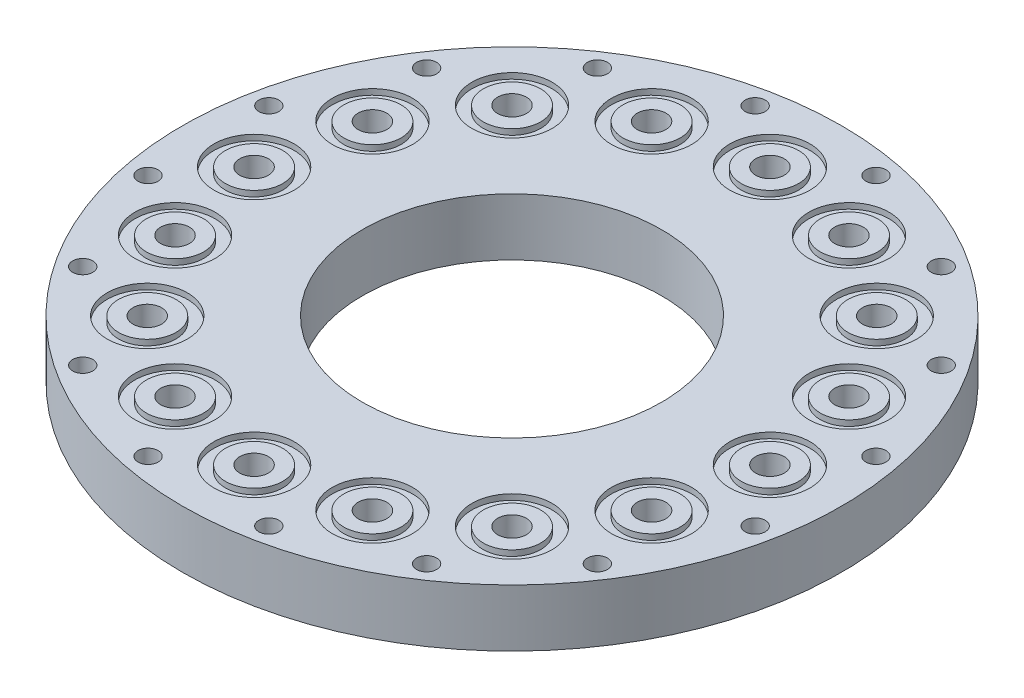
from build123d import *

# Parameters (mm, degrees)
SKETCH1_R           = 57.5
SKETCH1_R_2         = 1.75
SKETCH1_R_3         = 26.1
SKETCH1_R_4         = 2.5
BOSS_EXTRUDE1_DEPTH = 10
SKETCH2_R           = 7
SKETCH2_R_2         = 5
CUT_EXTRUDE1_DEPTH  = 1


with BuildPart() as part:
    # Sketch1 → Boss-Extrude1 (new body)
    with BuildSketch(Plane(origin=(0, 0, 0), x_dir=(1, 0, 0), z_dir=(0, 1, 0))):
        Circle(SKETCH1_R)
        with Locations((-10.534877389, 52.962405142)):
            Circle(SKETCH1_R_2, mode=Mode.SUBTRACT)
        with Locations((10.534877389, 52.962405142)):
            Circle(SKETCH1_R_2, mode=Mode.SUBTRACT)
        with Locations((30.000792583, 44.899359064)):
            Circle(SKETCH1_R_2, mode=Mode.SUBTRACT)
        with Locations((44.899359064, 30.000792583)):
            Circle(SKETCH1_R_2, mode=Mode.SUBTRACT)
        with Locations((52.962405142, 10.534877389)):
            Circle(SKETCH1_R_2, mode=Mode.SUBTRACT)
        with Locations((52.962405142, -10.534877389)):
            Circle(SKETCH1_R_2, mode=Mode.SUBTRACT)
        with Locations((44.899359064, -30.000792583)):
            Circle(SKETCH1_R_2, mode=Mode.SUBTRACT)
        with Locations((30.000792583, -44.899359064)):
            Circle(SKETCH1_R_2, mode=Mode.SUBTRACT)
        with Locations((10.534877389, -52.962405142)):
            Circle(SKETCH1_R_2, mode=Mode.SUBTRACT)
        with Locations((-10.534877389, -52.962405142)):
            Circle(SKETCH1_R_2, mode=Mode.SUBTRACT)
        with Locations((-30.000792583, -44.899359064)):
            Circle(SKETCH1_R_2, mode=Mode.SUBTRACT)
        with Locations((-44.899359064, -30.000792583)):
            Circle(SKETCH1_R_2, mode=Mode.SUBTRACT)
        Circle(SKETCH1_R_3, mode=Mode.SUBTRACT)
        with Locations((0, 45)):
            Circle(SKETCH1_R_4, mode=Mode.SUBTRACT)
        with Locations((17.220754456, 41.574578963)):
            Circle(SKETCH1_R_4, mode=Mode.SUBTRACT)
        with Locations((31.819805153, 31.819805153)):
            Circle(SKETCH1_R_4, mode=Mode.SUBTRACT)
        with Locations((41.574578963, 17.220754456)):
            Circle(SKETCH1_R_4, mode=Mode.SUBTRACT)
        with Locations((45, 0)):
            Circle(SKETCH1_R_4, mode=Mode.SUBTRACT)
        with Locations((41.574578963, -17.220754456)):
            Circle(SKETCH1_R_4, mode=Mode.SUBTRACT)
        with Locations((31.819805153, -31.819805153)):
            Circle(SKETCH1_R_4, mode=Mode.SUBTRACT)
        with Locations((17.220754456, -41.574578963)):
            Circle(SKETCH1_R_4, mode=Mode.SUBTRACT)
        with Locations((0, -45)):
            Circle(SKETCH1_R_4, mode=Mode.SUBTRACT)
        with Locations((-17.220754456, -41.574578963)):
            Circle(SKETCH1_R_4, mode=Mode.SUBTRACT)
        with Locations((-31.819805153, -31.819805153)):
            Circle(SKETCH1_R_4, mode=Mode.SUBTRACT)
        with Locations((-41.574578963, -17.220754456)):
            Circle(SKETCH1_R_4, mode=Mode.SUBTRACT)
        with Locations((-45, 0)):
            Circle(SKETCH1_R_4, mode=Mode.SUBTRACT)
        with Locations((-41.574578963, 17.220754456)):
            Circle(SKETCH1_R_4, mode=Mode.SUBTRACT)
        with Locations((-31.819805153, 31.819805153)):
            Circle(SKETCH1_R_4, mode=Mode.SUBTRACT)
        with Locations((-17.220754456, 41.574578963)):
            Circle(SKETCH1_R_4, mode=Mode.SUBTRACT)
        with Locations((-52.962405142, -10.534877389)):
            Circle(SKETCH1_R_2, mode=Mode.SUBTRACT)
        with Locations((-52.962405142, 10.534877389)):
            Circle(SKETCH1_R_2, mode=Mode.SUBTRACT)
        with Locations((-44.899359064, 30.000792583)):
            Circle(SKETCH1_R_2, mode=Mode.SUBTRACT)
        with Locations((-30.000792583, 44.899359064)):
            Circle(SKETCH1_R_2, mode=Mode.SUBTRACT)
    extrude(amount=BOSS_EXTRUDE1_DEPTH)

    # Sketch2 → Cut-Extrude1 (cut)
    # profile 1 of 16: a face of its own
    with BuildSketch(Plane(origin=(0, 10, 0), x_dir=(1, 0, 0), z_dir=(0, 1, 0))):
        with Locations((0, 45)):
            Circle(SKETCH2_R)
        with Locations((0, 45)):
            Circle(SKETCH2_R_2, mode=Mode.SUBTRACT)
    # profile 2 of 16: a face of its own
    with BuildSketch(Plane(origin=(0, 10, 0), x_dir=(1, 0, 0), z_dir=(0, 1, 0))):
        with Locations((17.220754456, 41.574578963)):
            Circle(SKETCH2_R)
        with Locations((17.220754456, 41.574578963)):
            Circle(SKETCH2_R_2, mode=Mode.SUBTRACT)
    # profile 3 of 16: a face of its own
    with BuildSketch(Plane(origin=(0, 10, 0), x_dir=(1, 0, 0), z_dir=(0, 1, 0))):
        with Locations((31.819805153, 31.819805153)):
            Circle(SKETCH2_R)
        with Locations((31.819805153, 31.819805153)):
            Circle(SKETCH2_R_2, mode=Mode.SUBTRACT)
    # profile 4 of 16: a face of its own
    with BuildSketch(Plane(origin=(0, 10, 0), x_dir=(1, 0, 0), z_dir=(0, 1, 0))):
        with Locations((41.574578963, 17.220754456)):
            Circle(SKETCH2_R)
        with Locations((41.574578963, 17.220754456)):
            Circle(SKETCH2_R_2, mode=Mode.SUBTRACT)
    # profile 5 of 16: a face of its own
    with BuildSketch(Plane(origin=(0, 10, 0), x_dir=(1, 0, 0), z_dir=(0, 1, 0))):
        with Locations((45, 0)):
            Circle(SKETCH2_R)
        with Locations((45, 0)):
            Circle(SKETCH2_R_2, mode=Mode.SUBTRACT)
    # profile 6 of 16: a face of its own
    with BuildSketch(Plane(origin=(0, 10, 0), x_dir=(1, 0, 0), z_dir=(0, 1, 0))):
        with Locations((41.574578963, -17.220754456)):
            Circle(SKETCH2_R)
        with Locations((41.574578963, -17.220754456)):
            Circle(SKETCH2_R_2, mode=Mode.SUBTRACT)
    # profile 7 of 16: a face of its own
    with BuildSketch(Plane(origin=(0, 10, 0), x_dir=(1, 0, 0), z_dir=(0, 1, 0))):
        with Locations((31.819805153, -31.819805153)):
            Circle(SKETCH2_R)
        with Locations((31.819805153, -31.819805153)):
            Circle(SKETCH2_R_2, mode=Mode.SUBTRACT)
    # profile 8 of 16: a face of its own
    with BuildSketch(Plane(origin=(0, 10, 0), x_dir=(1, 0, 0), z_dir=(0, 1, 0))):
        with Locations((17.220754456, -41.574578963)):
            Circle(SKETCH2_R)
        with Locations((17.220754456, -41.574578963)):
            Circle(SKETCH2_R_2, mode=Mode.SUBTRACT)
    # profile 9 of 16: a face of its own
    with BuildSketch(Plane(origin=(0, 10, 0), x_dir=(1, 0, 0), z_dir=(0, 1, 0))):
        with Locations((0, -45)):
            Circle(SKETCH2_R)
        with Locations((0, -45)):
            Circle(SKETCH2_R_2, mode=Mode.SUBTRACT)
    # profile 10 of 16: a face of its own
    with BuildSketch(Plane(origin=(0, 10, 0), x_dir=(1, 0, 0), z_dir=(0, 1, 0))):
        with Locations((-17.220754456, -41.574578963)):
            Circle(SKETCH2_R)
        with Locations((-17.220754456, -41.574578963)):
            Circle(SKETCH2_R_2, mode=Mode.SUBTRACT)
    # profile 11 of 16: a face of its own
    with BuildSketch(Plane(origin=(0, 10, 0), x_dir=(1, 0, 0), z_dir=(0, 1, 0))):
        with Locations((-31.819805153, -31.819805153)):
            Circle(SKETCH2_R)
        with Locations((-31.819805153, -31.819805153)):
            Circle(SKETCH2_R_2, mode=Mode.SUBTRACT)
    # profile 12 of 16: a face of its own
    with BuildSketch(Plane(origin=(0, 10, 0), x_dir=(1, 0, 0), z_dir=(0, 1, 0))):
        with Locations((-41.574578963, -17.220754456)):
            Circle(SKETCH2_R)
        with Locations((-41.574578963, -17.220754456)):
            Circle(SKETCH2_R_2, mode=Mode.SUBTRACT)
    # profile 13 of 16: a face of its own
    with BuildSketch(Plane(origin=(0, 10, 0), x_dir=(1, 0, 0), z_dir=(0, 1, 0))):
        with Locations((-45, 0)):
            Circle(SKETCH2_R)
        with Locations((-45, 0)):
            Circle(SKETCH2_R_2, mode=Mode.SUBTRACT)
    # profile 14 of 16: a face of its own
    with BuildSketch(Plane(origin=(0, 10, 0), x_dir=(1, 0, 0), z_dir=(0, 1, 0))):
        with Locations((-41.574578963, 17.220754456)):
            Circle(SKETCH2_R)
        with Locations((-41.574578963, 17.220754456)):
            Circle(SKETCH2_R_2, mode=Mode.SUBTRACT)
    # profile 15 of 16: a face of its own
    with BuildSketch(Plane(origin=(0, 10, 0), x_dir=(1, 0, 0), z_dir=(0, 1, 0))):
        with Locations((-31.819805153, 31.819805153)):
            Circle(SKETCH2_R)
        with Locations((-31.819805153, 31.819805153)):
            Circle(SKETCH2_R_2, mode=Mode.SUBTRACT)
    # profile 16 of 16: a face of its own
    with BuildSketch(Plane(origin=(0, 10, 0), x_dir=(1, 0, 0), z_dir=(0, 1, 0))):
        with Locations((-17.220754456, 41.574578963)):
            Circle(SKETCH2_R)
        with Locations((-17.220754456, 41.574578963)):
            Circle(SKETCH2_R_2, mode=Mode.SUBTRACT)
    extrude(amount=-CUT_EXTRUDE1_DEPTH, mode=Mode.SUBTRACT)


solid = part.part
